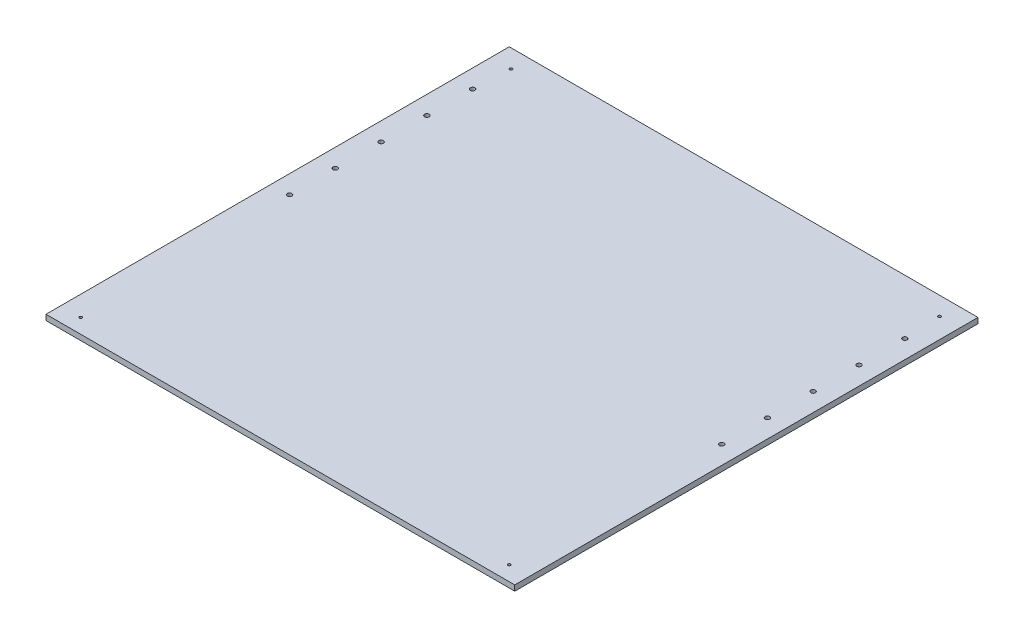
from build123d import *

# Parameters (mm, degrees)
SKETCH1_W           = 500
SKETCH1_H           = 500
SKETCH1_R           = 1.525
SKETCH1_R_2         = 1.5
BOSS_EXTRUDE1_DEPTH = 6
BOSS_EXTRUDE2_DEPTH = 6
SKETCH3_R           = 2.5
CUT_EXTRUDE1_DEPTH  = 716.617216115


with BuildPart() as part:
    # Sketch1 → Boss-Extrude1 (new body)
    with BuildSketch(Plane(origin=(0, 0, 0), x_dir=(1, 0, 0), z_dir=(0, 1, 0))):
        with Locations((250, -250)):
            Rectangle(SKETCH1_W, SKETCH1_H)
        with Locations((484, -20)):
            Circle(SKETCH1_R, mode=Mode.SUBTRACT)
        with Locations((16, -20)):
            Circle(SKETCH1_R_2, mode=Mode.SUBTRACT)
        with Locations((16, -490)):
            Circle(SKETCH1_R_2, mode=Mode.SUBTRACT)
        with Locations((484, -490)):
            Circle(SKETCH1_R_2, mode=Mode.SUBTRACT)
    extrude(amount=BOSS_EXTRUDE1_DEPTH)

    # Sketch2 → Boss-Extrude2 (add)
    with BuildSketch(Plane.XZ):
        Polygon((-6, 506), (-6, 0), (0, 0), (0, 500), (500, 500), (500, 0), (506, 0), (506, 506), align=None)
    extrude(amount=-BOSS_EXTRUDE2_DEPTH)

    # Sketch3 → Cut-Extrude1 (cut, through all)
    with BuildSketch(Plane.XZ):
        with Locations((14, 60)):
            Circle(SKETCH3_R)
        with Locations((14, 110)):
            Circle(SKETCH3_R)
        with Locations((14, 160)):
            Circle(SKETCH3_R)
        with Locations((14, 210)):
            Circle(SKETCH3_R)
        with Locations((14, 260)):
            Circle(SKETCH3_R)
        with Locations((486, 60)):
            Circle(SKETCH3_R)
        with Locations((486, 110)):
            Circle(SKETCH3_R)
        with Locations((486, 160)):
            Circle(SKETCH3_R)
        with Locations((486, 210)):
            Circle(SKETCH3_R)
        with Locations((486, 260)):
            Circle(SKETCH3_R)
    extrude(amount=-CUT_EXTRUDE1_DEPTH, mode=Mode.SUBTRACT)


solid = part.part
